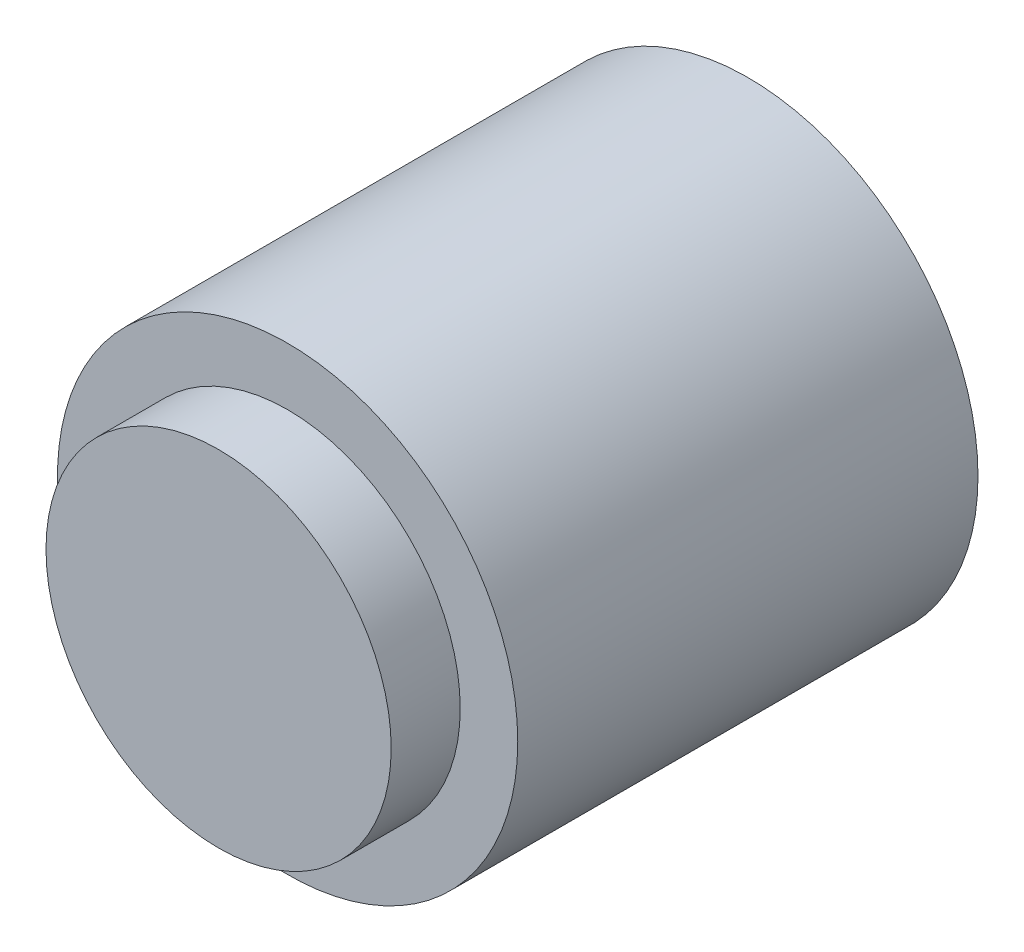
from build123d import *

# Parameters (mm, degrees)
EXTRUDE_START      = 592
EXTRUDE_SKETCH_1_R = 20
EXTRUDE_1_DEPTH    = 40
EXTRUDE_START_2    = 632
EXTRUDE_SKETCH_2_R = 15
EXTRUDE_2_DEPTH    = 6


with BuildPart() as part:
    # Extrude sketch 1 → Extrude 1 (new body)
    with BuildSketch(Plane.XY.offset(EXTRUDE_START)):
        with Locations((118, 0)):
            Circle(EXTRUDE_SKETCH_1_R)
    extrude(amount=EXTRUDE_1_DEPTH)


with BuildPart() as body_2:
    # Extrude sketch 2 → Extrude 2 (new body)
    with BuildSketch(Plane.XY.offset(EXTRUDE_START_2)):
        with Locations((118, 0)):
            Circle(EXTRUDE_SKETCH_2_R)
    extrude(amount=EXTRUDE_2_DEPTH)

    # Combine (weld / assembly of features): union part
    add(part.part)


solid = body_2.part
